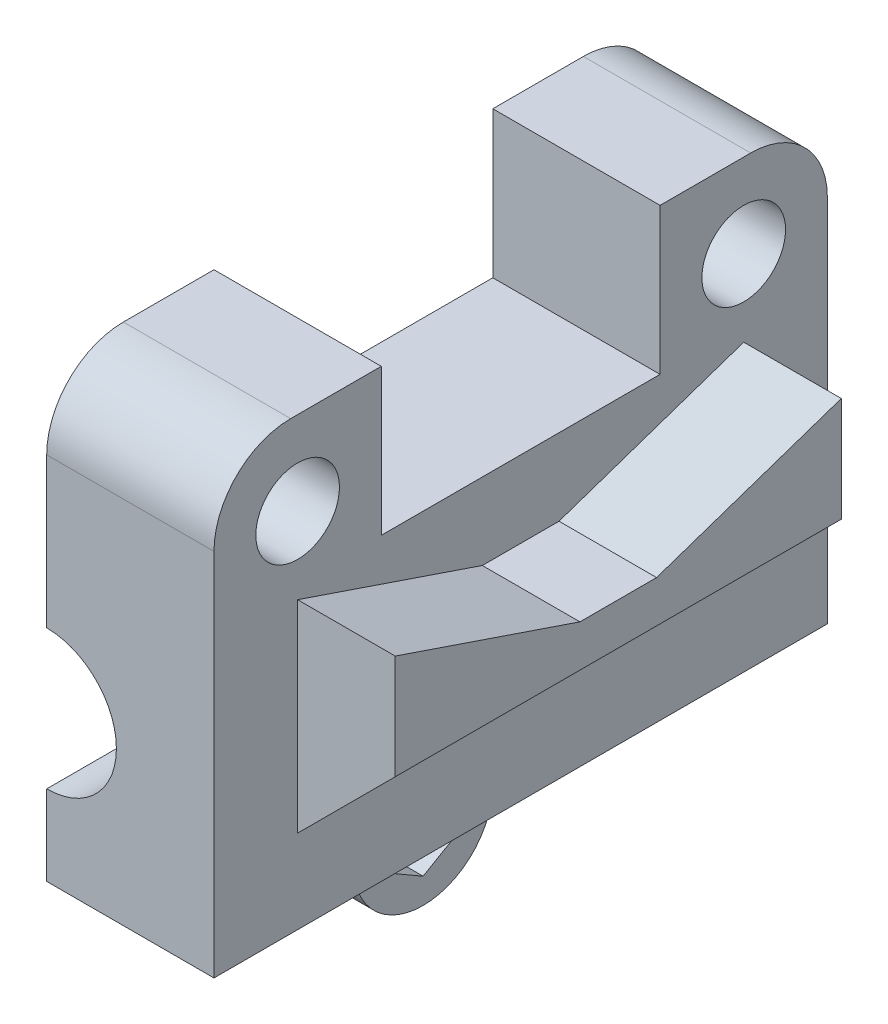
from build123d import *

# Parameters (mm, degrees)
SKETCH1_W               = 44
SKETCH1_H               = 32
BOSS_EXTRUDE1_DEPTH     = 12
SKETCH2_W               = 24.5
SKETCH2_H               = 15.5
CUT_EXTRUDE1_DEPTH      = 7.75
FILLET1_R               = 7.75
CUT_EXTRUDE2_DEPTH      = 40.661851949
CUT_EXTRUDE2_DEPTH_BACK = 40.661851949
SKETCH4_R               = 3
SKETCH4_W               = 20
SKETCH4_H               = 10.5
CUT_EXTRUDE3_DEPTH      = 30.732137495
SKETCH5_W               = 5.5
SKETCH5_H               = 3
BOSS_EXTRUDE4_DEPTH     = 7
CHAMFER1_SIZE           = 7
SKETCH6_W               = 11.5
SKETCH6_H               = 7
CUT_EXTRUDE5_DEPTH      = 30.732137495
FILLET4_R               = 5.5
SKETCH7_W               = 10
SKETCH7_H               = 10
SKETCH7_R               = 2
BOSS_EXTRUDE5_DEPTH     = 5
CUT_EXTRUDE6_START      = -2
SKETCH8_R               = 2
CUT_EXTRUDE6_DEPTH      = 2
FILLET5_R               = 5


with BuildPart() as part:
    # Sketch1 → Boss-Extrude1 (new body)
    with BuildSketch(Plane(origin=(0, 0, 0), x_dir=(0, 0, -1), z_dir=(1, 0, 0))):
        Rectangle(SKETCH1_W, SKETCH1_H)
    extrude(amount=BOSS_EXTRUDE1_DEPTH)

    # Sketch2 → Cut-Extrude1 (cut)
    with BuildSketch(Plane(origin=(0, 0, 0), x_dir=(0, 0, -1), z_dir=(1, 0, 0))):
        with Locations((0, -5.25)):
            Rectangle(SKETCH2_W, SKETCH2_H)
    extrude(amount=CUT_EXTRUDE1_DEPTH, mode=Mode.SUBTRACT)

    # Fillet1
    fillet1_edges = [part.edges().sort_by_distance(p)[0] for p in [
        (7.75, 2.5, 0),
        (7.75, -13, 0),
    ]]
    fillet(fillet1_edges, radius=FILLET1_R - 0.0001)  # a hair under: the kernel refuses the full size

    # Sketch3 → Cut-Extrude2 (cut, two sides: drawn at the far end of the back side and taken through both)
    with BuildSketch(Plane.XY.offset(-12.25).offset(-CUT_EXTRUDE2_DEPTH_BACK)):
        with BuildLine():
            ThreePointArc((0, -10.25), (3.535533906, -8.785533906), (5, -5.25))
            ThreePointArc((5, -5.25), (3.535533906, -1.714466094), (0, -0.25))
            Line((0, -0.25), (0, -10.25))
        make_face()
        with BuildLine():
            Line((0, -10.25), (0, -0.25))
            ThreePointArc((0, -0.25), (-5, -5.25), (0, -10.25))
        make_face()
    extrude(amount=CUT_EXTRUDE2_DEPTH + CUT_EXTRUDE2_DEPTH_BACK, mode=Mode.SUBTRACT)

    # Sketch4 → Cut-Extrude3 (cut, through all)
    with BuildSketch(Plane(origin=(12, 0, 0), x_dir=(0, 0, -1), z_dir=(1, 0, 0))):
        with Locations((-16, 10)):
            Circle(SKETCH4_R)
        with Locations((16, 10)):
            Circle(SKETCH4_R)
        with Locations((0, 10.75)):
            Rectangle(SKETCH4_W, SKETCH4_H)
    extrude(amount=-CUT_EXTRUDE3_DEPTH, mode=Mode.SUBTRACT)

    # Sketch5 → Boss-Extrude4 (add)
    with BuildSketch(Plane(origin=(12, 0, 0), x_dir=(0, 0, -1), z_dir=(1, 0, 0))):
        Polygon((-16, -3), (-16, 4.5), (-2.75, -3), align=None)
        Polygon((-2.75, -3), (-16, 4.5), (-2.75, 0), align=None)
        with Locations((0, -1.5)):
            Rectangle(SKETCH5_W, SKETCH5_H)
        Polygon((2.75, -3), (2.75, 0), (16, 4.5), align=None)
        Polygon((16, -3), (2.75, -3), (16, 4.5), align=None)
    extrude(amount=BOSS_EXTRUDE4_DEPTH)

    # Chamfer1
    chamfer1_edges = [part.edges().sort_by_distance(p)[0] for p in [
        (12, -3, 0),
    ]]
    chamfer(chamfer1_edges, length=CHAMFER1_SIZE - 0.0001)  # a hair under: the kernel refuses the full size

    # Sketch6 → Cut-Extrude5 (cut, through all)
    with BuildSketch(Plane(origin=(12, 0, 0), x_dir=(0, 0, -1), z_dir=(1, 0, 0))):
        with Locations((-7.25, -6.5)):
            Rectangle(SKETCH6_W, SKETCH6_H)
        with Locations((7.25, -6.5)):
            Rectangle(SKETCH6_W, SKETCH6_H)
    extrude(amount=CUT_EXTRUDE5_DEPTH, mode=Mode.SUBTRACT)

    # Fillet4
    fillet4_edges = [part.edges().sort_by_distance(p)[0] for p in [
        (6, 16, 22),
        (6, 16, -22),
    ]]
    fillet(fillet4_edges, radius=FILLET4_R)

    # Sketch7 → Boss-Extrude5 (add)
    with BuildSketch(Plane(origin=(0, 0, 0), x_dir=(0, 0, -1), z_dir=(1, 0, 0))):
        with Locations((0, -21)):
            Rectangle(SKETCH7_W, SKETCH7_H)
        with Locations((0, -21)):
            Circle(SKETCH7_R, mode=Mode.SUBTRACT)
    extrude(amount=BOSS_EXTRUDE5_DEPTH)

    # Sketch8 → Cut-Extrude6 (cut)
    with BuildSketch(Plane(origin=(5, 0, 0), x_dir=(0, 0, -1), z_dir=(1, 0, 0)).offset(CUT_EXTRUDE6_START)):
        Polygon((0, -24.175426481), (2.75, -22.58771324), (2.75, -19.41228676), (0, -17.824573519), (-2.75, -19.41228676), (-2.75, -22.58771324), align=None)
        with Locations((0, -21)):
            Circle(SKETCH8_R, mode=Mode.SUBTRACT)
    extrude(amount=CUT_EXTRUDE6_DEPTH, mode=Mode.SUBTRACT)

    # Fillet5
    fillet5_edges = [part.edges().sort_by_distance(p)[0] for p in [
        (2.5, -26, -5),
        (2.5, -26, 5),
    ]]
    fillet(fillet5_edges, radius=FILLET5_R - 0.0001)  # a hair under: the kernel refuses the full size


solid = part.part
